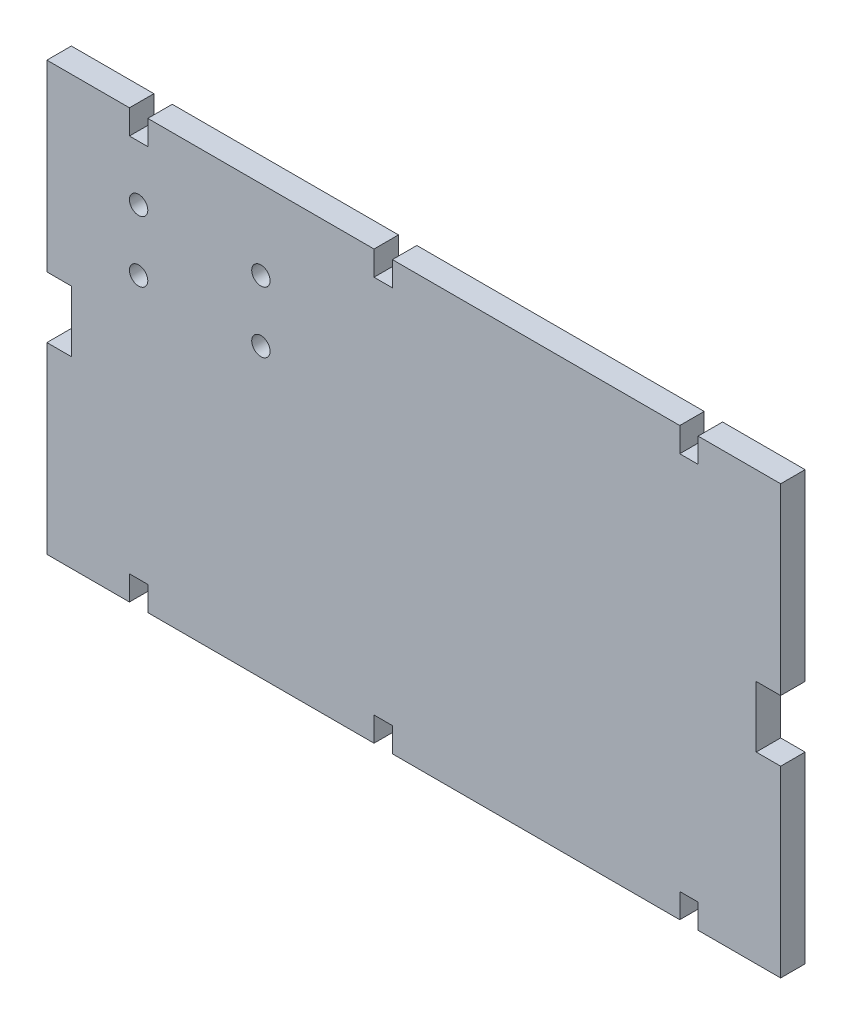
from build123d import *

# Parameters (mm, degrees)
SKETCH1_W           = 120
SKETCH1_H           = 70
BOSS_EXTRUDE1_DEPTH = 4
SKETCH2_W           = 4
SKETCH2_H           = 10
SKETCH2_W_2         = 3
SKETCH2_H_2         = 4
CUT_EXTRUDE1_DEPTH  = 4
SKETCH3_R           = 1.5
CUT_EXTRUDE2_DEPTH  = 4


with BuildPart() as part:
    # Sketch1 → Boss-Extrude1 (new body)
    with BuildSketch(Plane.XY):
        with Locations((60, 35)):
            Rectangle(SKETCH1_W, SKETCH1_H)
    extrude(amount=BOSS_EXTRUDE1_DEPTH)

    # Sketch2 → Cut-Extrude1 (cut)
    with BuildSketch(Plane.XY.offset(4)):
        with Locations((118, 35)):
            Rectangle(SKETCH2_W, SKETCH2_H)
        with Locations((105, 68)):
            Rectangle(SKETCH2_W_2, SKETCH2_H_2)
        with Locations((105, 2)):
            Rectangle(SKETCH2_W_2, SKETCH2_H_2)
        with Locations((55, 68)):
            Rectangle(SKETCH2_W_2, SKETCH2_H_2)
        with Locations((55, 2)):
            Rectangle(SKETCH2_W_2, SKETCH2_H_2)
        with Locations((15, 68)):
            Rectangle(SKETCH2_W_2, SKETCH2_H_2)
        with Locations((15, 2)):
            Rectangle(SKETCH2_W_2, SKETCH2_H_2)
        with Locations((2, 35)):
            Rectangle(SKETCH2_W, SKETCH2_H)
    extrude(amount=-CUT_EXTRUDE1_DEPTH, mode=Mode.SUBTRACT)

    # Sketch3 → Cut-Extrude2 (cut)
    with BuildSketch(Plane.XY.offset(4)):
        with Locations((35, 47)):
            Circle(SKETCH3_R)
        with Locations((35, 57)):
            Circle(SKETCH3_R)
        with Locations((15, 57)):
            Circle(SKETCH3_R)
        with Locations((15, 47)):
            Circle(SKETCH3_R)
    extrude(amount=-CUT_EXTRUDE2_DEPTH, mode=Mode.SUBTRACT)


solid = part.part
